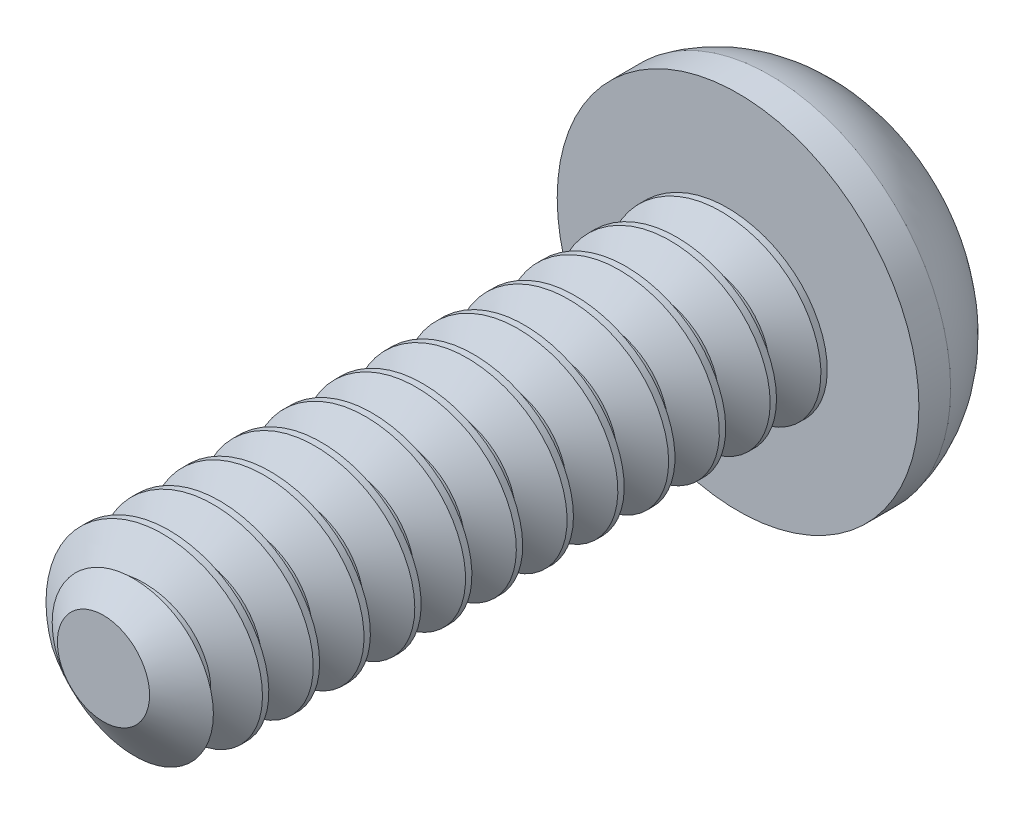
from build123d import *

# Parameters (mm, degrees)
SKETCH1_R          = 1.5
EXTRUDE1_DEPTH     = 10
CUT_SWEEP1_PITCH   = 0.8
SKETCH6_R          = 2.85
EXTRUDE2_DEPTH     = 2
CUT_EXTRUDE1_DEPTH = 1.5
SKETCH8_R          = 1.154700538
CUT_EXTRUDE2_DEPTH = 13.658791551
CUT_EXTRUDE2_TAPER = 45


with BuildPart() as part:
    # Sketch1 → Extrude1 (new body)
    with BuildSketch(Plane.XY):
        Circle(SKETCH1_R)
    extrude(amount=-EXTRUDE1_DEPTH)

    # Cut-Sweep1: the profile of Sketch3 profile screwed along a right-hand helix of 13.5 turns, 6 arcs to a turn; built about Z, then put on its axis
    cut_sweep1_z = Axis((0, 0, 0), (0, 0, 1))
    cut_sweep1_corners = [(1.5003, 0, -0.700173205), (0.980384758, 0, -0.4), (0.980384758, 0, -0.3), (1.5003, 0, 0.000173205)]
    with BuildLine(mode=Mode.PRIVATE) as cut_sweep1_profile:
        Line(cut_sweep1_corners[0], cut_sweep1_corners[1])
        Line(cut_sweep1_corners[1], cut_sweep1_corners[2])
        Line(cut_sweep1_corners[2], cut_sweep1_corners[3])
        Line(cut_sweep1_corners[3], cut_sweep1_corners[0])
    cut_sweep1_cap = Face(cut_sweep1_profile.wire())
    cut_sweep1_turn_angles = [0, 30, 60, 90, 120, 150, 180, 210, 240, 270, 300, 330, 360]
    cut_sweep1_turn_weights = [1, 0.8660254037844387, 1, 0.8660254037844387, 1, 0.8660254037844387, 1, 0.8660254037844387, 1, 0.8660254037844387, 1, 0.8660254037844387, 1]
    cut_sweep1_turn_rails = [Edge.make_bspline([Vector(p[0], p[1], 0).rotate(cut_sweep1_z, cut_sweep1_turn_angles[k]) / cut_sweep1_turn_weights[k] + Vector(0, 0, p[2] + CUT_SWEEP1_PITCH * cut_sweep1_turn_angles[k] / 360) for k in range(13)], [0, 0, 0, 1, 1, 2, 2, 3, 3, 4, 4, 5, 5, 6, 6, 6], 2, cut_sweep1_turn_weights) for p in cut_sweep1_corners]
    cut_sweep1_turn_sides = [Face.make_surface_from_curves(cut_sweep1_turn_rails[p[0]], cut_sweep1_turn_rails[p[1]]) for p in [(0, 1), (1, 2), (2, 3), (3, 0)]]
    cut_sweep1_last_angles = [4680, 4710, 4740, 4770, 4800, 4830, 4860]
    cut_sweep1_last_weights = [1, 0.8660254037844387, 1, 0.8660254037844387, 1, 0.8660254037843712, 1]
    cut_sweep1_last_rails = [Edge.make_bspline([Vector(p[0], p[1], 0).rotate(cut_sweep1_z, cut_sweep1_last_angles[k]) / cut_sweep1_last_weights[k] + Vector(0, 0, p[2] + CUT_SWEEP1_PITCH * cut_sweep1_last_angles[k] / 360) for k in range(7)], [0, 0, 0, 1, 1, 2, 2, 3, 3, 3], 2, cut_sweep1_last_weights) for p in cut_sweep1_corners]
    cut_sweep1_last_sides = [Face.make_surface_from_curves(cut_sweep1_last_rails[p[0]], cut_sweep1_last_rails[p[1]]) for p in [(0, 1), (1, 2), (2, 3), (3, 0)]]
    cut_sweep1 = Plane(origin=(0, 0, 0), x_dir=(0, 1, 0), z_dir=(0, 0, -1)) * Solid(Shell([*[p.moved(Location((0, 0, CUT_SWEEP1_PITCH * i))) for i in range(13) for p in cut_sweep1_turn_sides], *cut_sweep1_last_sides, cut_sweep1_cap, cut_sweep1_cap.rotate(cut_sweep1_z, 4860).moved(Location((0, 0, CUT_SWEEP1_PITCH * 4860 / 360)))]))
    add(cut_sweep1, mode=Mode.SUBTRACT)

    # Sketch4 → Cut-Revolve1 (revolve, cut)
    with BuildSketch(Plane(origin=(0, 0, 0), x_dir=(0, 0, -1), z_dir=(1, 0, 0)), mode=Mode.PRIVATE) as cut_revolve1_sk:
        Polygon((0.541691224, 1.5), (0, 0.726384758), (0, 1.5), align=None)
    revolve(cut_revolve1_sk.sketch.rotate(Axis((0, 0, 0), (0, 0, -1)), 260.43858876), axis=Axis((0, 0, 0), (0, 0, -1)), mode=Mode.SUBTRACT)

    # Sketch6 → Extrude2 (add)
    with BuildSketch(Plane(origin=(0, 0, -10), x_dir=(-1, 0, 0), z_dir=(0, 0, -1))):
        Circle(SKETCH6_R)
    extrude(amount=EXTRUDE2_DEPTH)

    # Sketch10 → Cut-Revolve2 (revolve, cut)
    with BuildSketch(Plane(origin=(0, 0, 0), x_dir=(0, 0, -1), z_dir=(1, 0, 0)), mode=Mode.PRIVATE) as cut_revolve2_sk:
        with BuildLine():
            Line((10.5, 2.85), (10.5, 3.35))
            Line((10.5, 3.35), (12.5, 3.35))
            Line((12.5, 3.35), (12.5, 1))
            Line((12.5, 1), (12, 1))
            ThreePointArc((12, 1), (11.577882328, 2.190850536), (10.5, 2.85))
        make_face()
    revolve(cut_revolve2_sk.sketch.rotate(Axis((0, 0, 0), (0, 0, -1)), 90), axis=Axis((0, 0, 0), (0, 0, -1)), mode=Mode.SUBTRACT)

    # Sketch7 → Cut-Extrude1 (cut)
    with BuildSketch(Plane(origin=(0, 0, -12), x_dir=(-1, 0, 0), z_dir=(0, 0, -1))):
        Polygon((0, 1.154700538), (-1, 0.577350269), (-1, -0.577350269), (0, -1.154700538), (1, -0.577350269), (1, 0.577350269), align=None)
    extrude(amount=-CUT_EXTRUDE1_DEPTH, mode=Mode.SUBTRACT)

    # Sketch8 → Cut-Extrude2 (cut, through all)
    with BuildSketch(Plane.XY.offset(-12)):
        Circle(SKETCH8_R)
    extrude(amount=CUT_EXTRUDE2_DEPTH, taper=CUT_EXTRUDE2_TAPER, mode=Mode.SUBTRACT)


solid = part.part
